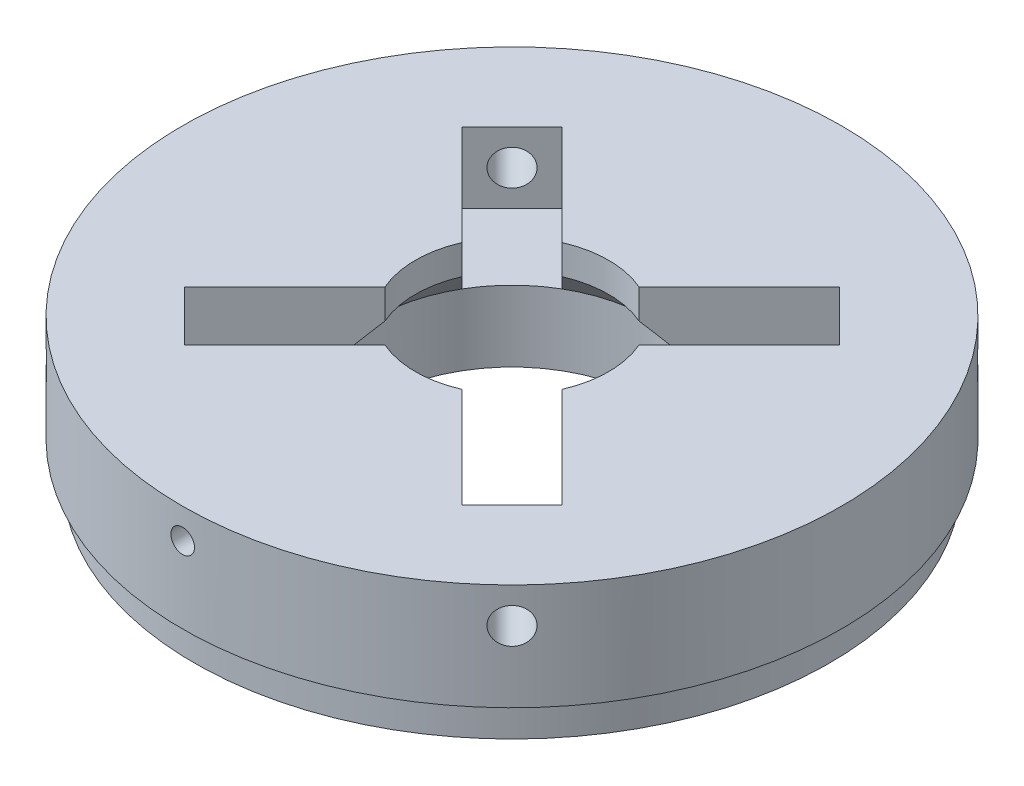
from build123d import *

# Parameters (mm, degrees)
SKETCH1_R               = 27.889608224
BOSS_EXTRUDE1_DEPTH     = 6
CUT_EXTRUDE1_REACH      = 61.354
CUT_EXTRUDE1_END_RADIUS = 27.889608224
SKETCH2_R               = 1.5
CIRPATTERN1_COUNT       = 4
CHAMFER1_SIZE           = 3.5
BOSS_EXTRUDE2_START     = 6
SKETCH3_R               = 27.889608224
SKETCH3_R_2             = 11.678118969
BOSS_EXTRUDE2_DEPTH     = 6
CUT_EXTRUDE2_REACH      = 64.651
SKETCH4_R               = 1
SKETCH5_R               = 27.889608224
SKETCH5_R_2             = 26.889608224
SKETCH5_R_3             = 25.031826588
SKETCH5_R_4             = 19.031826588
CUT_EXTRUDE3_DEPTH      = 3
FILLET1_R               = 3


with BuildPart() as part:
    # Sketch1 → Boss-Extrude1 (new body)
    with BuildSketch(Plane(origin=(0, 0, 0), x_dir=(1, 0, 0), z_dir=(0, 1, 0))):
        with Locations(Location((0, 0, 0), (0, 0, 270))):
            Circle(SKETCH1_R)
        with BuildLine():
            ThreePointArc((-7.500987149, 3.258346461), (-8.178118969, 0), (-7.500987149, -3.258346461))
            Line((-7.500987149, -3.258346461), (-15.986268523, -11.743627836))
            Line((-15.986268523, -11.743627836), (-11.743627836, -15.986268523))
            Line((-11.743627836, -15.986268523), (-3.258346461, -7.500987149))
            ThreePointArc((-3.258346461, -7.500987149), (0, -8.178118969), (3.258346461, -7.500987149))
            Line((3.258346461, -7.500987149), (11.743627836, -15.986268523))
            Line((11.743627836, -15.986268523), (15.986268523, -11.743627836))
            Line((15.986268523, -11.743627836), (7.500987149, -3.258346461))
            ThreePointArc((7.500987149, -3.258346461), (8.178118969, 0), (7.500987149, 3.258346461))
            Line((7.500987149, 3.258346461), (15.986268523, 11.743627836))
            Line((15.986268523, 11.743627836), (11.743627836, 15.986268523))
            Line((11.743627836, 15.986268523), (3.258346461, 7.500987149))
            ThreePointArc((3.258346461, 7.500987149), (0, 8.178118969), (-3.258346461, 7.500987149))
            Line((-3.258346461, 7.500987149), (-11.743627836, 15.986268523))
            Line((-11.743627836, 15.986268523), (-15.986268523, 11.743627836))
            Line((-15.986268523, 11.743627836), (-7.500987149, 3.258346461))
        make_face(mode=Mode.SUBTRACT)
    extrude(amount=BOSS_EXTRUDE1_DEPTH)

    # Cut-Extrude1: up to this cylinder (the profile starts inside it)
    cut_extrude1_end = Plane(origin=(0, 3, 0), z_dir=(0, -1, 0)) * Cylinder(CUT_EXTRUDE1_END_RADIUS, 179.487216449, mode=Mode.PRIVATE)
    # Sketch2 → Cut-Extrude1 (cut, up to the surface)
    with BuildSketch(Plane(origin=(13.864948179, 0, -13.864948179), x_dir=(0.7071067811865458, 0, 0.7071067811865492), z_dir=(-0.7071067811865492, 0, 0.7071067811865458)), mode=Mode.PRIVATE) as cut_extrude1_sk1:
        with Locations((0, 3)):
            Circle(SKETCH2_R)
    cut_extrude1_tool1 = extrude(cut_extrude1_sk1.sketch, amount=-CUT_EXTRUDE1_REACH, mode=Mode.PRIVATE) & cut_extrude1_end
    cut_extrude1 = cut_extrude1_tool1.solids().sort_by_distance((13.864948, 3, -13.864948))[0]
    add(cut_extrude1, mode=Mode.SUBTRACT)

    # CirPattern1: Cut-Extrude1 ×4 about axis
    cirpattern1_axis = Axis((0, 6, 0), (0, -1, 0))
    for i in range(1, CIRPATTERN1_COUNT):
        add(cut_extrude1.rotate(cirpattern1_axis, i * 360 / CIRPATTERN1_COUNT), mode=Mode.SUBTRACT)

    # Chamfer1
    chamfer1_edges = [part.edges().sort_by_distance(p)[0] for p in [
        (0, 0, 8.178118969),
        (8.178118969, 0, 0),
        (0, 0, -8.178118969),
        (-8.178118969, 0, 0),
    ]]
    chamfer(chamfer1_edges, length=CHAMFER1_SIZE)

    # Sketch3 → Boss-Extrude2 (add)
    with BuildSketch(Plane.XZ.offset(BOSS_EXTRUDE2_START)):
        with Locations(Location((0, 0, 0), (0, 0, 270))):
            Circle(SKETCH3_R)
        with Locations(Location((0, 0, 0), (0, 0, 59.885646145))):
            Circle(SKETCH3_R_2, mode=Mode.SUBTRACT)
    extrude(amount=-BOSS_EXTRUDE2_DEPTH)

    # Sketch4 → Cut-Extrude2 (cut, up to next)
    with BuildSketch(Plane.XY.offset(27.889608224), mode=Mode.PRIVATE) as cut_extrude2_sk1:
        with Locations((0, 3.461741733)):
            Circle(SKETCH4_R)
    cut_extrude2_tool1 = extrude(cut_extrude2_sk1.sketch, amount=-CUT_EXTRUDE2_REACH, mode=Mode.PRIVATE) & part.part
    add(cut_extrude2_tool1.solids().sort_by_distance((0, 3.461742, 27.889608))[0], mode=Mode.SUBTRACT)

    # Sketch5 → Cut-Extrude3 (cut)
    # profile 1 of 2: a face of its own
    with BuildSketch(Plane.XZ.offset(6)):
        with Locations(Location((0, 0, 0), (0, 0, 270))):
            Circle(SKETCH5_R)
        with Locations(Location((0, 0, 0), (0, 0, 270))):
            Circle(SKETCH5_R_2, mode=Mode.SUBTRACT)
    # profile 2 of 2: a face of its own
    with BuildSketch(Plane.XZ.offset(6)):
        with Locations(Location((0, 0, 0), (0, 0, 270))):
            Circle(SKETCH5_R_3)
        with Locations(Location((0, 0, 0), (0, 0, 270))):
            Circle(SKETCH5_R_4, mode=Mode.SUBTRACT)
    extrude(amount=-CUT_EXTRUDE3_DEPTH, mode=Mode.SUBTRACT)

    # Fillet1
    fillet1_edges = [part.edges().sort_by_distance(p)[0] for p in [
        (0, -3, 25.031826588),
        (0, -3, 19.031826588),
    ]]
    fillet(fillet1_edges, radius=FILLET1_R - 0.0001)  # a hair under: the kernel refuses the full size


solid = part.part
